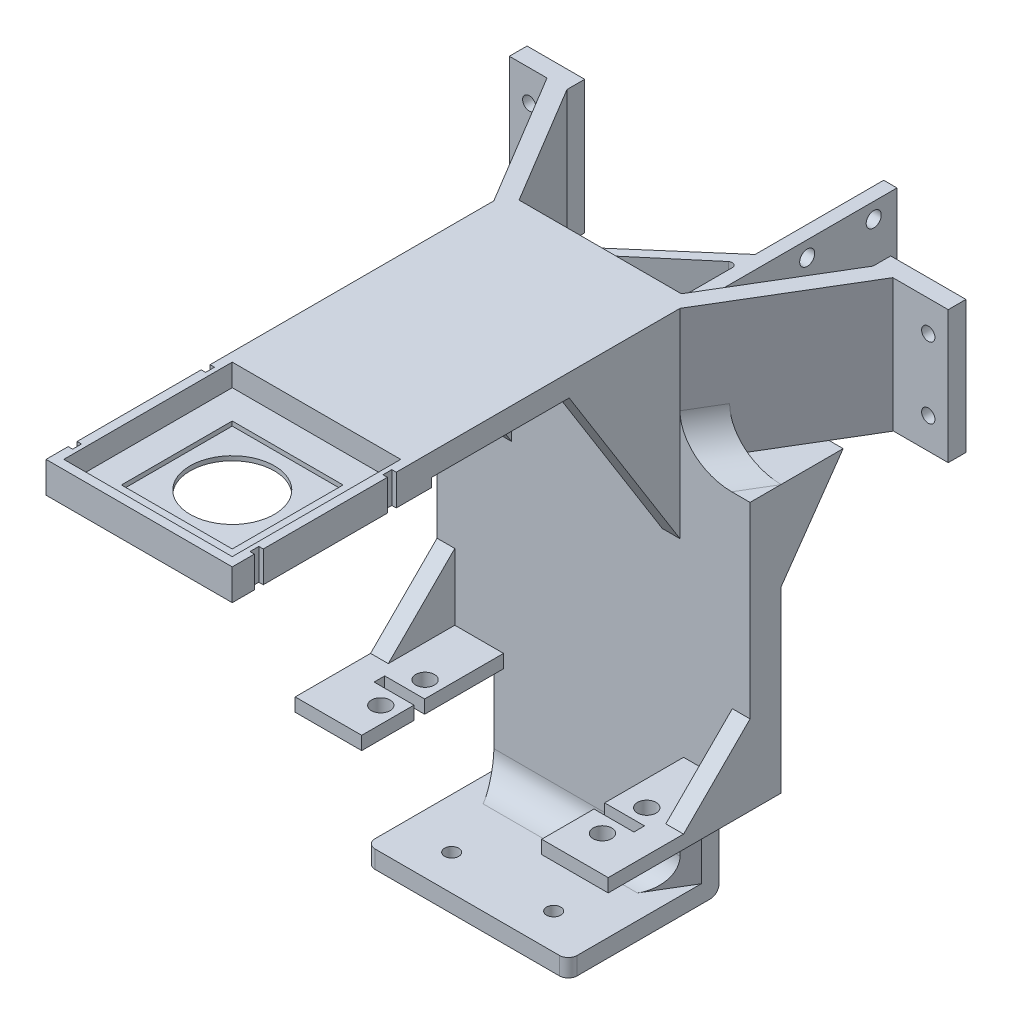
from build123d import *

# Parameters (mm, degrees)
SKETCH_1_W                  = 13
SKETCH_1_H                  = 30
SKETCH_1_R                  = 1.5
EXTRUDE_1_DEPTH             = 4
SKETCH_1_H_2                = 29.9
EXTRUDE_1_2_DEPTH           = 4
EXTRUDE_2_REACH             = 55.892
EXTRUDE_2_DIRECTION_2_REACH = 55.892
EXTRUDE_4_DEPTH             = 87
EXTRUDE_START               = -3
SKETCH_8_W                  = 45.6
SKETCH_8_H                  = 4
EXTRUDE_5_DEPTH             = 30
FILLET_1_R                  = 6
SKETCH_10_W                 = 3
SKETCH_10_H                 = 22
EXTRUDE_6_DEPTH             = 50
SKETCH_13_R                 = 1.7
CUT_EXTRUDE_3_DEPTH         = 4
FILLET_3_R                  = 6
SKETCH_14_R                 = 1.6
CUT_EXTRUDE_4_DEPTH         = 10
SKETCH_22_W                 = 42
SKETCH_22_H                 = 5
EXTRUDE_13_DEPTH            = 90
SKETCH_23_W                 = 42
SKETCH_23_H                 = 42
SKETCH_23_W_2               = 38
SKETCH_23_H_2               = 38
EXTRUDE_14_DEPTH            = 5
SKETCH_24_W                 = 38
SKETCH_24_H                 = 38
CUT_EXTRUDE_6_DEPTH         = 5
EXTRUDE_17_DEPTH            = 40
EXTRUDE_17_DEPTH_BACK       = 5
SKETCH_26_W                 = 42
SKETCH_26_H                 = 2
SKETCH_27_W                 = 25
SKETCH_27_H                 = 25
CUT_EXTRUDE_7_DEPTH         = 1
SKETCH_28_R                 = 9.5
CUT_EXTRUDE_8_DEPTH         = 1
EXTRUDE_18_DEPTH            = 4
EXTRUDE_19_DEPTH            = 4
FILLET_4_R                  = 6
SKETCH_31_W                 = 2
SKETCH_31_H                 = 7
CUT_EXTRUDE_9_DEPTH         = 1
SKETCH_32_W                 = 2
SKETCH_32_H                 = 7
CUT_EXTRUDE_10_DEPTH        = 1
SKETCH_34_W                 = 3.981671923
SKETCH_34_H                 = 4
EXTRUDE_20_DEPTH            = 29.9
SKETCH_15_W                 = 15
SKETCH_15_H                 = 3
EXTRUDE_29_DEPTH            = 35
EXTRUDE_30_REACH            = 191.684
SKETCH_45_W                 = 3
SKETCH_45_H                 = 50
EXTRUDE_31_REACH            = 191.236
SKETCH_46_W                 = 3
SKETCH_46_H                 = 50
SKETCH_47_R                 = 2.1
SKETCH_47_W                 = 9
SKETCH_47_H                 = 2.4
CUT_EXTRUDE_13_DEPTH        = 4
EXTRUDE_32_DEPTH            = 4
EXTRUDE_33_DEPTH            = 4
EXTRUDE_34_DEPTH            = 22
FILLET_9_R                  = 2
FILLET_10_R                 = 1
EXTRUDE_35_REACH            = 191.236
SKETCH_51_W                 = 3
SKETCH_51_H                 = 10.3
EXTRUDE_36_REACH            = 191.684
SKETCH_52_W                 = 3
SKETCH_52_H                 = 10.3
SKETCH_55_W                 = 70.6
SKETCH_55_H                 = 60.3
EXTRUDE_39_DEPTH            = 4
FILLET_11_R                 = 10
EXTRUDE_START_2             = -70.6
EXTRUDE_41_DEPTH            = 70.6
SKETCH_61_W                 = 4
SKETCH_61_H                 = 26.7
EXTRUDE_42_DEPTH            = 45.6
FILLET_12_R                 = 2


with BuildPart() as part:
    # 草图1 → 凸台-拉伸1 (new body)
    with BuildSketch(Plane.XY):
        with Locations((-41, -0.366795367)):
            Rectangle(SKETCH_1_W, SKETCH_1_H)
        with Locations((-43, 7.683204633)):
            Circle(SKETCH_1_R, mode=Mode.SUBTRACT)
        with Locations((-43, -8.316795367)):
            Circle(SKETCH_1_R, mode=Mode.SUBTRACT)
    extrude(amount=EXTRUDE_1_DEPTH)

    # 凸台-拉伸2: up to this face of the body (flat: up to its plane)
    extrude_2_end = Plane(part.part.faces().sort_by_distance((-41, 14.633204633, 2))[0])
    # 草图2 → 凸台-拉伸2 (add, up to the picked face)
    with BuildSketch(Plane(origin=(0, 0, 0), x_dir=(1, 0, 0), z_dir=(0, 1, 0)), mode=Mode.PRIVATE) as extrude_2_sk1:
        Polygon((-39, -4), (-21, -34), (21, -34), (39, -4), (34.5, -4), (18.3, -31), (-18.3, -31), (-34.5, -4), align=None)
    extrude_2_tool1 = split(extrude(extrude_2_sk1.sketch, amount=EXTRUDE_2_REACH, mode=Mode.PRIVATE), bisect_by=extrude_2_end, keep=Keep.BOTH, mode=Mode.PRIVATE)
    add(extrude_2_tool1.solids().sort_by(Axis((-29.28339, 0, 18.570034), (0, 1, 0)))[0])

    # 凸台-拉伸2 direction 2: up to this face of the body (flat: up to its plane)
    extrude_2_direction_2_end = Plane(part.part.faces().sort_by_distance((-41, -15.366795367, 2))[0])
    # 草图2 → 凸台-拉伸2 direction 2 (add, up to the picked face)
    with BuildSketch(Plane(origin=(0, 0, 0), x_dir=(1, 0, 0), z_dir=(0, 1, 0)), mode=Mode.PRIVATE) as extrude_2_direction_2_sk1:
        Polygon((-39, -4), (-21, -34), (21, -34), (39, -4), (34.5, -4), (18.3, -31), (-18.3, -31), (-34.5, -4), align=None)
    extrude_2_direction_2_tool1 = split(extrude(extrude_2_direction_2_sk1.sketch, amount=-EXTRUDE_2_DIRECTION_2_REACH, mode=Mode.PRIVATE), bisect_by=extrude_2_direction_2_end, keep=Keep.BOTH, mode=Mode.PRIVATE)
    add(extrude_2_direction_2_tool1.solids().sort_by(Axis((-29.28339, 0, 18.570034), (0, -1, 0)))[0])

    # 草图6 → 凸台-拉伸4 (add)
    with BuildSketch(Plane.XZ.offset(15.366795367)):
        Polygon((-21, 31), (21.070673513, 31), (22.8, 31), (21, 34), (-21, 34), (-22.8, 31), align=None)
    extrude(amount=EXTRUDE_4_DEPTH)

    # 草图8 → 凸台-拉伸5 (add)
    with BuildSketch(Plane.XY.offset(34).offset(EXTRUDE_START)):
        with Locations((0, -100.366795367)):
            Rectangle(SKETCH_8_W, SKETCH_8_H)
    extrude(amount=EXTRUDE_5_DEPTH)

    # 圆角1
    fillet_1_edges = [part.edges().sort_by_distance(p)[0] for p in [
        (0, -98.366795367, 34),
    ]]
    fillet(fillet_1_edges, radius=FILLET_1_R)

    # 草图10 → 凸台-拉伸6 (add)
    with BuildSketch(Plane(origin=(0, 0, 31), x_dir=(-1, 0, 0), z_dir=(0, 0, -1))):
        with Locations((-15.445, -1.366795367)):
            Rectangle(SKETCH_10_W, SKETCH_10_H)
    extrude(amount=EXTRUDE_6_DEPTH)

    # 草图13 → 切除-拉伸3 (cut)
    with BuildSketch(Plane.ZY.offset(-13.945)):
        with Locations(Location((-13.75, 6.133204633, 0), (0, 0, 270))):
            Circle(SKETCH_13_R)
        with Locations(Location((-13.75, -8.866795367, 0), (0, 0, 270))):
            Circle(SKETCH_13_R)
        with Locations(Location((1.25, 6.133204633, 0), (0, 0, 270))):
            Circle(SKETCH_13_R)
        with Locations(Location((1.25, -8.866795367, 0), (0, 0, 270))):
            Circle(SKETCH_13_R)
    extrude(amount=-CUT_EXTRUDE_3_DEPTH, mode=Mode.SUBTRACT)

    # 圆角3
    fillet_3_edges = [part.edges().sort_by_distance(p)[0] for p in [
        (13.945, -1.366795367, 31),
    ]]
    fillet(fillet_3_edges, radius=FILLET_3_R)

    # 草图14 → 切除-拉伸4 (cut)
    with BuildSketch(Plane(origin=(0, -98.366795367, 0), x_dir=(1, 0, 0), z_dir=(0, 1, 0))):
        with Locations(Location((-11.5, -53, 0), (0, 0, 270))):
            Circle(SKETCH_14_R)
        with Locations(Location((11.5, -53, 0), (0, 0, 270))):
            Circle(SKETCH_14_R)
    extrude(amount=-CUT_EXTRUDE_4_DEPTH, mode=Mode.SUBTRACT)

    # 草图22 → 凸台-拉伸13 (add)
    with BuildSketch(Plane.XY.offset(34)):
        with Locations((0, 12.133204633)):
            Rectangle(SKETCH_22_W, SKETCH_22_H)
    extrude(amount=EXTRUDE_13_DEPTH)

    # 草图23 → 凸台-拉伸14 (add)
    with BuildSketch(Plane(origin=(0, 14.633204633, 0), x_dir=(1, 0, 0), z_dir=(0, 1, 0))):
        with Locations((0, -114)):
            Rectangle(SKETCH_23_W, SKETCH_23_H)
        with Locations((0, -114)):
            Rectangle(SKETCH_23_W_2, SKETCH_23_H_2, mode=Mode.SUBTRACT)
    extrude(amount=-EXTRUDE_14_DEPTH)

    # 草图24 → 切除-拉伸6 (cut)
    with BuildSketch(Plane(origin=(0, 14.633204633, 0), x_dir=(1, 0, 0), z_dir=(0, 1, 0))):
        with Locations((0, -114)):
            Rectangle(SKETCH_24_W, SKETCH_24_H)
    extrude(amount=-CUT_EXTRUDE_6_DEPTH, mode=Mode.SUBTRACT)

    # 草图26 → 凸台-拉伸17 (add, two sides: drawn at the far end of the back side and taken through both)
    with BuildSketch(Plane.XY.offset(95).offset(-EXTRUDE_17_DEPTH_BACK)):
        with Locations((0, 8.633204633)):
            Rectangle(SKETCH_26_W, SKETCH_26_H)
    extrude(amount=EXTRUDE_17_DEPTH + EXTRUDE_17_DEPTH_BACK)

    # 草图27 → 切除-拉伸7 (cut)
    with BuildSketch(Plane(origin=(0, 9.633204633, 0), x_dir=(1, 0, 0), z_dir=(0, 1, 0))):
        with Locations((0, -114)):
            Rectangle(SKETCH_27_W, SKETCH_27_H)
    extrude(amount=-CUT_EXTRUDE_7_DEPTH, mode=Mode.SUBTRACT)

    # 草图28 → 切除-拉伸8 (cut)
    with BuildSketch(Plane(origin=(0, 8.633204633, 0), x_dir=(1, 0, 0), z_dir=(0, 1, 0))):
        with Locations(Location((0, -114, 0), (0, 0, 180))):
            Circle(SKETCH_28_R)
    extrude(amount=-CUT_EXTRUDE_8_DEPTH, mode=Mode.SUBTRACT)

    # 草图29 → 凸台-拉伸18 (add)
    with BuildSketch(Plane.ZY.offset(21)):
        Polygon((34, -30.366795367), (59, 9.633204633), (34, 9.633204633), align=None)
    extrude(amount=-EXTRUDE_18_DEPTH)

    # 草图30 → 凸台-拉伸19 (add)
    with BuildSketch(Plane(origin=(21, 0, 0), x_dir=(0, 0, -1), z_dir=(1, 0, 0))):
        Polygon((-59, 9.633204633), (-34, -30.366795367), (-34, 9.633204633), align=None)
    extrude(amount=-EXTRUDE_19_DEPTH)

    # 圆角4
    fillet_4_edges = [part.edges().sort_by_distance(p)[0] for p in [
        (0, 9.633204633, 34),
    ]]
    fillet(fillet_4_edges, radius=FILLET_4_R)

    # 草图31 → 切除-拉伸9 (cut)
    with BuildSketch(Plane.ZY.offset(21)):
        with Locations((99, 11.133204633)):
            Rectangle(SKETCH_31_W, SKETCH_31_H)
        with Locations((129, 11.133204633)):
            Rectangle(SKETCH_31_W, SKETCH_31_H)
    extrude(amount=-CUT_EXTRUDE_9_DEPTH, mode=Mode.SUBTRACT)

    # 草图32 → 切除-拉伸10 (cut)
    with BuildSketch(Plane(origin=(21, 0, 0), x_dir=(0, 0, -1), z_dir=(1, 0, 0))):
        with Locations((-99, 11.133204633)):
            Rectangle(SKETCH_32_W, SKETCH_32_H)
        with Locations((-129, 11.133204633)):
            Rectangle(SKETCH_32_W, SKETCH_32_H)
    extrude(amount=-CUT_EXTRUDE_10_DEPTH, mode=Mode.SUBTRACT)



with BuildPart() as body_2:
    # 草图1 → Extrude 1 2 (new body)
    with BuildSketch(Plane.XY):
        with Locations((45, -0.316795367)):
            Rectangle(SKETCH_1_W, SKETCH_1_H_2)
        with Locations((47, -8.316795367)):
            Circle(SKETCH_1_R, mode=Mode.SUBTRACT)
        with Locations((47, 7.683204633)):
            Circle(SKETCH_1_R, mode=Mode.SUBTRACT)
    extrude(amount=EXTRUDE_1_2_DEPTH)


with BuildPart() as part_1:
    add(part.part)

    add(body_2.part)  # 凸台-拉伸20 merges body 2
    # 草图34 → 凸台-拉伸20 (add)
    with BuildSketch(Plane(origin=(0, 14.633204633, 0), x_dir=(1, 0, 0), z_dir=(0, 1, 0))):
        with Locations((36.509164039, -2)):
            Rectangle(SKETCH_34_W, SKETCH_34_H)
    extrude(amount=-EXTRUDE_20_DEPTH)

    # 草图15 → 凸台-拉伸29 (add)
    with BuildSketch(Plane(origin=(0, 0, 31), x_dir=(-1, 0, 0), z_dir=(0, 0, -1))):
        with Locations((26.3, -74.166795367)):
            Rectangle(SKETCH_15_W, SKETCH_15_H)
        with Locations((-29.3, -74.166795367)):
            Rectangle(SKETCH_15_W, SKETCH_15_H)
    extrude(amount=-EXTRUDE_29_DEPTH)

    # 凸台-拉伸30: up to this plane
    extrude_30_end = Plane(origin=(-39, 98.203534296, 4), z_dir=(0.857492925712544, 0, -0.5144957554275267))
    # 草图45 → 凸台-拉伸30 (add, up to the surface)
    with BuildSketch(Plane.ZY.offset(33.8), mode=Mode.PRIVATE) as extrude_30_sk1:
        with Locations((32.5, -50.666795367)):
            Rectangle(SKETCH_45_W, SKETCH_45_H)
    extrude_30_tool1 = split(extrude(extrude_30_sk1.sketch, amount=-EXTRUDE_30_REACH, mode=Mode.PRIVATE), bisect_by=extrude_30_end, keep=Keep.BOTH, mode=Mode.PRIVATE)
    add(extrude_30_tool1.solids().sort_by_distance((-33.8, -50.666795, 32.5))[0])

    # 凸台-拉伸31: up to this plane
    extrude_31_end = Plane(origin=(39, 98.203534296, 4), z_dir=(-0.8574929257125442, 0, -0.5144957554275266))
    # 草图46 → 凸台-拉伸31 (add, up to the surface)
    with BuildSketch(Plane(origin=(36.8, 0, 0), x_dir=(0, 0, -1), z_dir=(1, 0, 0)), mode=Mode.PRIVATE) as extrude_31_sk1:
        with Locations((-32.5, -50.666795367)):
            Rectangle(SKETCH_46_W, SKETCH_46_H)
    extrude_31_tool1 = split(extrude(extrude_31_sk1.sketch, amount=-EXTRUDE_31_REACH, mode=Mode.PRIVATE), bisect_by=extrude_31_end, keep=Keep.BOTH, mode=Mode.PRIVATE)
    add(extrude_31_tool1.solids().sort_by_distance((36.8, -50.666795, 32.5))[0])

    # 草图47 → 切除-拉伸13 (cut)
    with BuildSketch(Plane(origin=(0, -72.666795367, 0), x_dir=(1, 0, 0), z_dir=(0, 1, 0))):
        with Locations(Location((-22.5, -48, 0), (0, 0, 270))):
            Circle(SKETCH_47_R)
        with Locations(Location((-22.5, -58, 0), (0, 0, 270))):
            Circle(SKETCH_47_R)
        with Locations(Location((27.5, -48, 0), (0, 0, 270))):
            Circle(SKETCH_47_R)
        with Locations(Location((27.5, -58, 0), (0, 0, 270))):
            Circle(SKETCH_47_R)
        with Locations((26.3, -53)):
            Rectangle(SKETCH_47_W, SKETCH_47_H)
        with Locations((-23.3, -53)):
            Rectangle(SKETCH_47_W, SKETCH_47_H)
    extrude(amount=-CUT_EXTRUDE_13_DEPTH, mode=Mode.SUBTRACT)

    # 草图48 → 凸台-拉伸32 (add)
    with BuildSketch(Plane.ZY.offset(33.8)):
        Polygon((34, -57.666795367), (49, -72.666795367), (34, -72.666795367), align=None)
    extrude(amount=-EXTRUDE_32_DEPTH)

    # 草图49 → 凸台-拉伸33 (add)
    with BuildSketch(Plane(origin=(36.8, 0, 0), x_dir=(0, 0, -1), z_dir=(1, 0, 0))):
        Polygon((-34, -57.666795367), (-49, -72.666795367), (-34, -72.666795367), align=None)
    extrude(amount=-EXTRUDE_33_DEPTH)

    # 草图50 → 凸台-拉伸34 (add)
    with BuildSketch(Plane(origin=(0, 9.633204633, 0), x_dir=(1, 0, 0), z_dir=(0, 1, 0))):
        Polygon((-7.3, -31), (13.945, -13), (13.945, -10), (-10.3, -31), align=None)
    extrude(amount=-EXTRUDE_34_DEPTH)

    # 圆角9
    fillet_9_edges = [part_1.edges().sort_by_distance(p)[0] for p in [
        (-7.3, -1.366795367, 31),
    ]]
    fillet(fillet_9_edges, radius=FILLET_9_R)

    # 圆角10
    fillet_10_edges = [part_1.edges().sort_by_distance(p)[0] for p in [
        (13.945, -1.366795367, 13),
    ]]
    fillet(fillet_10_edges, radius=FILLET_10_R)

    # 凸台-拉伸35: up to this plane
    extrude_35_end = Plane(origin=(39, 98.203534296, 4), z_dir=(-0.8574929257125442, 0, -0.5144957554275266))
    # 草图51 → 凸台-拉伸35 (add, up to the surface)
    with BuildSketch(Plane(origin=(36.8, 0, 0), x_dir=(0, 0, -1), z_dir=(1, 0, 0)), mode=Mode.PRIVATE) as extrude_35_sk1:
        with Locations((-32.5, -20.516795367)):
            Rectangle(SKETCH_51_W, SKETCH_51_H)
    extrude_35_tool1 = split(extrude(extrude_35_sk1.sketch, amount=-EXTRUDE_35_REACH, mode=Mode.PRIVATE), bisect_by=extrude_35_end, keep=Keep.BOTH, mode=Mode.PRIVATE)
    add(extrude_35_tool1.solids().sort_by_distance((36.8, -20.516795, 32.5))[0])

    # 凸台-拉伸36: up to this plane
    extrude_36_end = Plane(origin=(-39, 98.203534296, 4), z_dir=(0.857492925712544, 0, -0.5144957554275267))
    # 草图52 → 凸台-拉伸36 (add, up to the surface)
    with BuildSketch(Plane.ZY.offset(33.8), mode=Mode.PRIVATE) as extrude_36_sk1:
        with Locations((32.5, -20.516795367)):
            Rectangle(SKETCH_52_W, SKETCH_52_H)
    extrude_36_tool1 = split(extrude(extrude_36_sk1.sketch, amount=-EXTRUDE_36_REACH, mode=Mode.PRIVATE), bisect_by=extrude_36_end, keep=Keep.BOTH, mode=Mode.PRIVATE)
    add(extrude_36_tool1.solids().sort_by_distance((-33.8, -20.516795, 32.5))[0])

    # 草图55 → 凸台-拉伸39 (add)
    with BuildSketch(Plane(origin=(0, 0, 31), x_dir=(-1, 0, 0), z_dir=(0, 0, -1))):
        with Locations((-1.5, -45.516795367)):
            Rectangle(SKETCH_55_W, SKETCH_55_H)
    extrude(amount=EXTRUDE_39_DEPTH)

    # 圆角11
    # the kernel refuses this fillet: 10 mm, written as the material it adds along each edge
    with BuildSketch(Plane(origin=(-38.062393886, -15.366795367, 5.562676857), x_dir=(0, 1, 0), z_dir=(0.5144957554275272, 0, 0.8574929257125439))) as fillet_11_piece_1_section:
        with BuildLine():
            CenterArc((FILLET_11_R, FILLET_11_R), FILLET_11_R, 180, 90)
            Line((0, FILLET_11_R), (0, 0))
            Line((0, 0), (FILLET_11_R, 0))
        make_face()
    fillet_11_piece_1 = extrude(amount=58.163332653, mode=Mode.PRIVATE)
    fillet_11_piece_1 = split(fillet_11_piece_1, bisect_by=Plane(origin=(-25.682376011, -13.127518809, 27), z_dir=(0, 0, 1)), keep=Keep.TOP, mode=Mode.PRIVATE)
    fillet_11_piece_1 = split(fillet_11_piece_1, bisect_by=Plane(origin=(-33.8, -13.127518809, 30.506418383), z_dir=(1, 0, 0)), keep=Keep.TOP, mode=Mode.PRIVATE)
    fillet_11_piece_1 = split(fillet_11_piece_1, bisect_by=Plane(origin=(-25.682376011, -13.127518809, 34), z_dir=(0, 0, -1)), keep=Keep.TOP, mode=Mode.PRIVATE)
    add(fillet_11_piece_1)
    with BuildSketch(Plane(origin=(8.137606114, -15.366795367, 55.437323143), x_dir=(0, 1, 0), z_dir=(0.5144957554275269, 0, -0.8574929257125441))) as fillet_11_piece_2_section:
        with BuildLine():
            CenterArc((FILLET_11_R, FILLET_11_R), FILLET_11_R, 180, 90)
            Line((0, FILLET_11_R), (0, 0))
            Line((0, 0), (FILLET_11_R, 0))
        make_face()
    fillet_11_piece_2 = extrude(amount=58.163332653, mode=Mode.PRIVATE)
    fillet_11_piece_2 = split(fillet_11_piece_2, bisect_by=Plane(origin=(25.704895409, -13.133115976, 27), z_dir=(0, 0, 1)), keep=Keep.TOP, mode=Mode.PRIVATE)
    fillet_11_piece_2 = split(fillet_11_piece_2, bisect_by=Plane(origin=(36.8, -13.133115976, 30.500000002), z_dir=(-1, 0, 0)), keep=Keep.TOP, mode=Mode.PRIVATE)
    fillet_11_piece_2 = split(fillet_11_piece_2, bisect_by=Plane(origin=(25.704895409, -13.133115976, 34), z_dir=(0, 0, -1)), keep=Keep.TOP, mode=Mode.PRIVATE)
    add(fillet_11_piece_2)

    # 草图58 → 凸台-拉伸41 (add)
    with BuildSketch(Plane(origin=(36.8, 0, 0), x_dir=(0, 0, -1), z_dir=(1, 0, 0)).offset(EXTRUDE_START_2)):
        Polygon((-27, -15.366654481), (-13.000000001, -15.366795367), (-27, -35.366654481), align=None)
    extrude(amount=EXTRUDE_41_DEPTH)

    # 草图61 → 凸台-拉伸42 (add)
    with BuildSketch(Plane(origin=(22.8, 0, 0), x_dir=(0, 0, -1), z_dir=(1, 0, 0))):
        with Locations((-29, -89.016795367)):
            Rectangle(SKETCH_61_W, SKETCH_61_H)
    extrude(amount=-EXTRUDE_42_DEPTH)

    # 圆角12
    fillet_12_edges = [part_1.edges().sort_by_distance(p)[0] for p in [
        (22.8, -100.366795367, 61),
        (-22.8, -100.366795367, 61),
        (0, -102.366795367, 27),
    ]]
    fillet(fillet_12_edges, radius=FILLET_12_R)


solid = part_1.part
